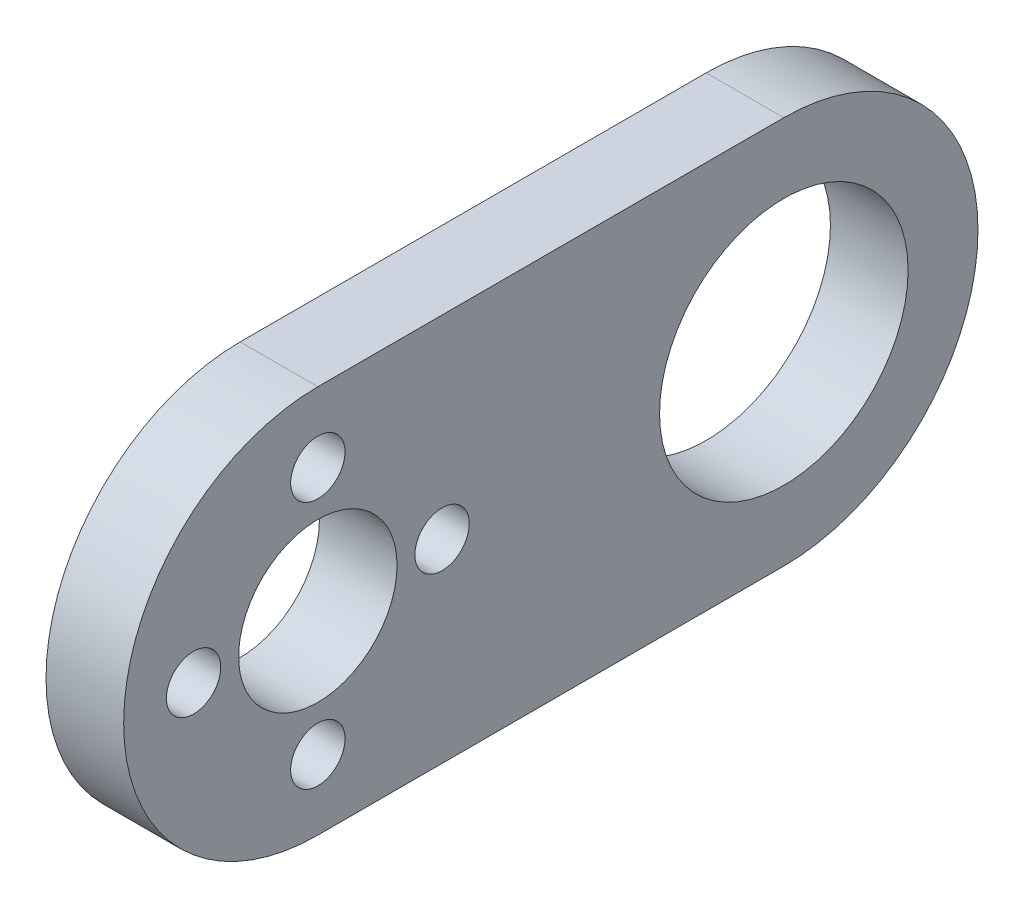
from build123d import *

# Parameters (mm, degrees)
CROQUIS1_R              = 8
CROQUIS1_R_2            = 5.1
CROQUIS1_R_3            = 1.75
SALIENTE_EXTRUIR1_DEPTH = 5


with BuildPart() as part:
    # Croquis1 → Saliente-Extruir1 (new body)
    with BuildSketch(Plane(origin=(0, 0, 0), x_dir=(0, 0, -1), z_dir=(1, 0, 0))):
        with BuildLine():
            Line((-15, -12.5), (15, -12.5))
            ThreePointArc((15, -12.5), (27.5, 0), (15, 12.5))
            Line((15, 12.5), (-15, 12.5))
            ThreePointArc((-15, 12.5), (-27.5, 0), (-15, -12.5))
        make_face()
        with Locations((15, 0)):
            Circle(CROQUIS1_R, mode=Mode.SUBTRACT)
        with Locations((-15, 0)):
            Circle(CROQUIS1_R_2, mode=Mode.SUBTRACT)
        with Locations((-23, 0)):
            Circle(CROQUIS1_R_3, mode=Mode.SUBTRACT)
        with Locations((-15, 8)):
            Circle(CROQUIS1_R_3, mode=Mode.SUBTRACT)
        with Locations((-7, 0)):
            Circle(CROQUIS1_R_3, mode=Mode.SUBTRACT)
        with Locations((-15, -8)):
            Circle(CROQUIS1_R_3, mode=Mode.SUBTRACT)
    extrude(amount=SALIENTE_EXTRUIR1_DEPTH)


solid = part.part
